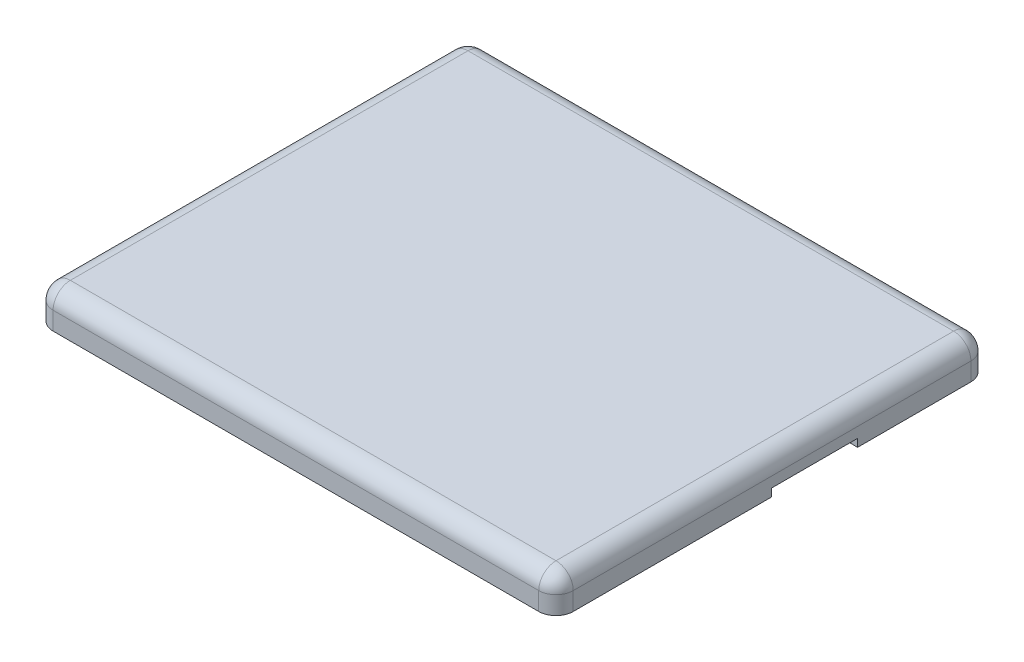
from build123d import *

# Parameters (mm, degrees)
SKETCH1_W          = 60.3
SKETCH1_H          = 50.1
OUTERWALLS_DEPTH   = 2
SKETCH2_W          = 60.3
SKETCH2_H          = 50.1
SKETCH2_W_2        = 57.9
SKETCH2_H_2        = 47.7
INNER_DEPTH        = 2.1
SKETCH4_W          = 10
SKETCH4_H          = 3.7
CUT_EXTRUDE1_DEPTH = 20
FILLET1_R          = 2


with BuildPart() as part:
    # Sketch1 → OuterWalls (new body)
    with BuildSketch(Plane(origin=(0, 0, 0), x_dir=(1, 0, 0), z_dir=(0, 1, 0))):
        Rectangle(SKETCH1_W, SKETCH1_H)
    extrude(amount=-OUTERWALLS_DEPTH)

    # Sketch2 → Inner (add)
    with BuildSketch(Plane(origin=(0, -2, 0), x_dir=(-1, 0, 0), z_dir=(0, -1, 0))):
        Rectangle(SKETCH2_W, SKETCH2_H)
        Rectangle(SKETCH2_W_2, SKETCH2_H_2, mode=Mode.SUBTRACT)
    extrude(amount=INNER_DEPTH)

    # Sketch4 → Cut-Extrude1 (cut)
    with BuildSketch(Plane(origin=(30.15, 0, 0), x_dir=(0, 0, -1), z_dir=(1, 0, 0))):
        with Locations((4.91675286, -5.05)):
            Rectangle(SKETCH4_W, SKETCH4_H)
    extrude(amount=-CUT_EXTRUDE1_DEPTH, mode=Mode.SUBTRACT)

    # Fillet1
    fillet1_edges = [part.edges().sort_by_distance(p)[0] for p in [
        (30.15, 0, 0),
        (-30.15, -2.05, 25.05),
        (-30.15, -2.05, -25.05),
        (30.15, -2.05, -25.05),
        (30.15, -2.05, 25.05),
        (0, 0, 25.05),
        (-30.15, 0, 0),
        (0, 0, -25.05),
    ]]
    fillet(fillet1_edges, radius=FILLET1_R)


solid = part.part
